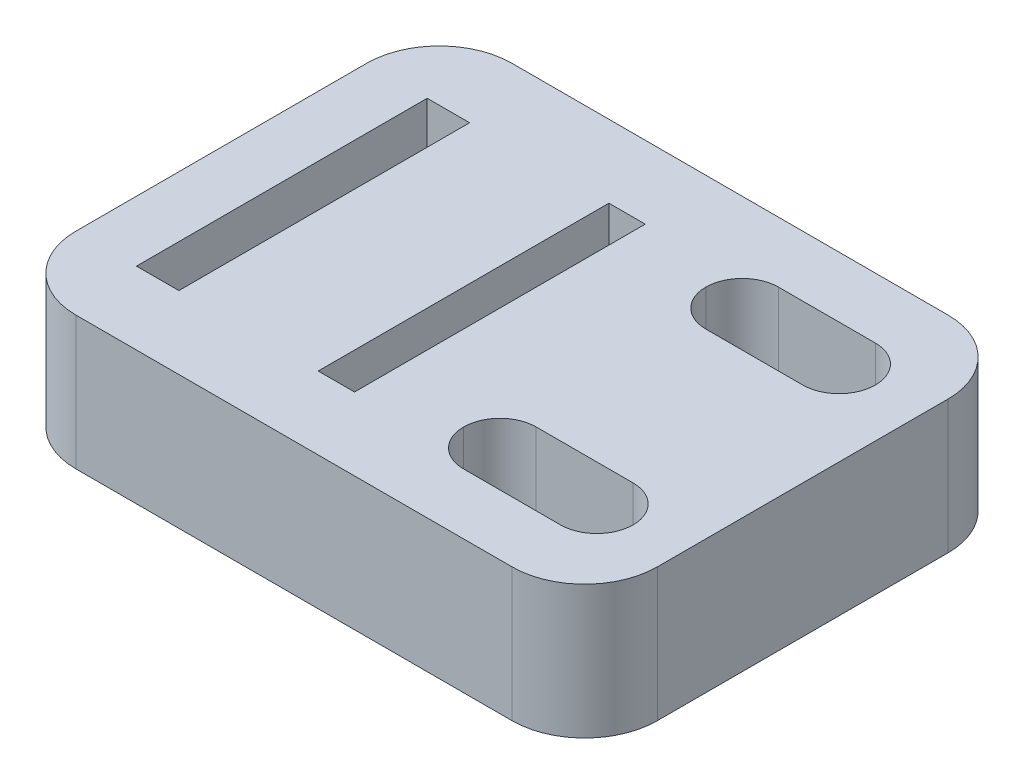
from build123d import *

# Parameters (mm, degrees)
SKETCH1_W           = 24
SKETCH1_H           = 18
SKETCH1_W_2         = 1.5
SKETCH1_H_2         = 12
SKETCH1_W_3         = 1.75
SKETCH1_W_4         = 7
SKETCH1_H_3         = 3
BOSS_EXTRUDE1_DEPTH = 5.5
FILLET1_R           = 3
FILLET2_R           = 3
FILLET4_R           = 1.5
FILLET5_R           = 1.5


with BuildPart() as part:
    # Sketch1 → Boss-Extrude1 (new body)
    with BuildSketch(Plane(origin=(0, 0, 0), x_dir=(1, 0, 0), z_dir=(0, 1, 0))):
        with Locations((-12, 9)):
            Rectangle(SKETCH1_W, SKETCH1_H)
        with Locations((-13.25, 9)):
            Rectangle(SKETCH1_W_2, SKETCH1_H_2, mode=Mode.SUBTRACT)
        with Locations((-20.625, 9)):
            Rectangle(SKETCH1_W_3, SKETCH1_H_2, mode=Mode.SUBTRACT)
        with Locations((-5.5, 14)):
            Rectangle(SKETCH1_W_4, SKETCH1_H_3, mode=Mode.SUBTRACT)
        with Locations((-5.5, 4)):
            Rectangle(SKETCH1_W_4, SKETCH1_H_3, mode=Mode.SUBTRACT)
    extrude(amount=BOSS_EXTRUDE1_DEPTH)

    # Fillet1
    fillet1_edges = [part.edges().sort_by_distance(p)[0] for p in [
        (0, 2.75, 0),
    ]]
    fillet(fillet1_edges, radius=FILLET1_R)

    # Fillet2
    fillet2_edges = [part.edges().sort_by_distance(p)[0] for p in [
        (-24, 2.75, 0),
        (-24, 2.75, -18),
        (0, 2.75, -18),
    ]]
    fillet(fillet2_edges, radius=FILLET2_R)

    # Fillet4
    fillet4_edges = [part.edges().sort_by_distance(p)[0] for p in [
        (-9, 2.75, -15.5),
        (-9, 2.75, -5.5),
        (-9, 2.75, -12.5),
        (-9, 2.75, -2.5),
        (-2, 2.75, -2.5),
    ]]
    fillet(fillet4_edges, radius=FILLET4_R - 0.0001)  # a hair under: the kernel refuses the full size

    # Fillet5
    fillet5_edges = [part.edges().sort_by_distance(p)[0] for p in [
        (-2, 2.75, -12.5),
        (-2, 2.75, -5.5),
        (-2, 2.75, -15.5),
    ]]
    fillet(fillet5_edges, radius=FILLET5_R - 0.0001)  # a hair under: the kernel refuses the full size


solid = part.part
